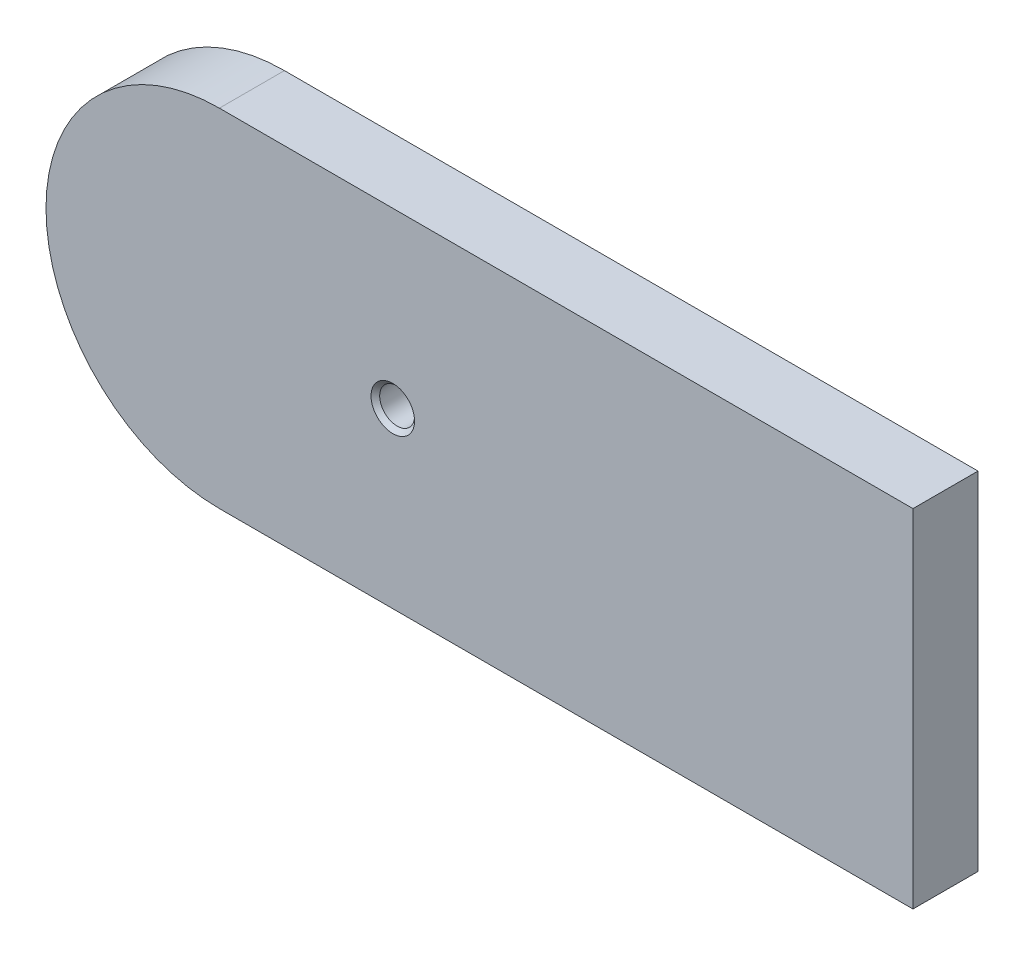
from build123d import *

# Parameters (mm, degrees)
SKETCH1_W               = 152.4
SKETCH1_H               = 50.8
BOSS_EXTRUDE2_DEPTH     = 9.525
CUT_EXTRUDE1_START      = -9.525
CUT_EXTRUDE1_DEPTH      = 9.525
CUT_EXTRUDE2_DEPTH      = 81.884643938
CUT_EXTRUDE2_DEPTH_BACK = 81.884643938


# Read off the part's stored shape, not the designer's step: Cut-Extrude1
with BuildPart() as part:
    # Sketch1 → Boss-Extrude2 (new body)
    with BuildSketch(Plane.XY):
        Rectangle(SKETCH1_W, SKETCH1_H)
    extrude(amount=BOSS_EXTRUDE2_DEPTH)

    # Sketch2 → 1/4-20 Tapped Hole1 (revolve, cut)
    with BuildSketch(Plane(origin=(-25.4, 0, 9.525), x_dir=(0, -1, 0), z_dir=(1, 0, 0))):
        Polygon((0, 0), (0, 9.525), (3.1877, 9.525), (2.5527, 8.89), (2.5527, 0.635), (3.1877, 0), align=None)
    revolve(axis=Axis((-25.4, 0, 15.875), (0, 0, -1)), mode=Mode.SUBTRACT)

    # Cut-Extrude1 outline → Cut-Extrude1 (cut)
    with BuildSketch(Plane.XY.offset(9.525).offset(CUT_EXTRUDE1_START)):
        with BuildLine():
            Line((-76.2, -25.4), (-50.8, -25.4))
            ThreePointArc((-50.8, -25.4), (-68.760512242, -17.960512242), (-76.2, 0))
            Line((-76.2, 0), (-76.2, -25.4))
        make_face()
        with BuildLine():
            Line((-76.2, 25.4), (-76.2, 0))
            ThreePointArc((-76.2, 0), (-68.760512242, 17.960512242), (-50.8, 25.4))
            Line((-50.8, 25.4), (-76.2, 25.4))
        make_face()
    extrude(amount=CUT_EXTRUDE1_DEPTH, mode=Mode.SUBTRACT)

    # Sketch5 → Cut-Extrude2 (cut, two sides: drawn at the far end of the back side and taken through both)
    with BuildSketch(Plane.XY.offset(9.525).offset(-CUT_EXTRUDE2_DEPTH_BACK)):
        Polygon((50.8, -359.042550973), (50.8, -51.798163577), (50.8, 47.427693525), (50.8, 354.672080921), (665.288774792, 354.672080921), (665.288774792, -359.042550973), align=None)
    extrude(amount=CUT_EXTRUDE2_DEPTH + CUT_EXTRUDE2_DEPTH_BACK, mode=Mode.SUBTRACT)


solid = part.part
